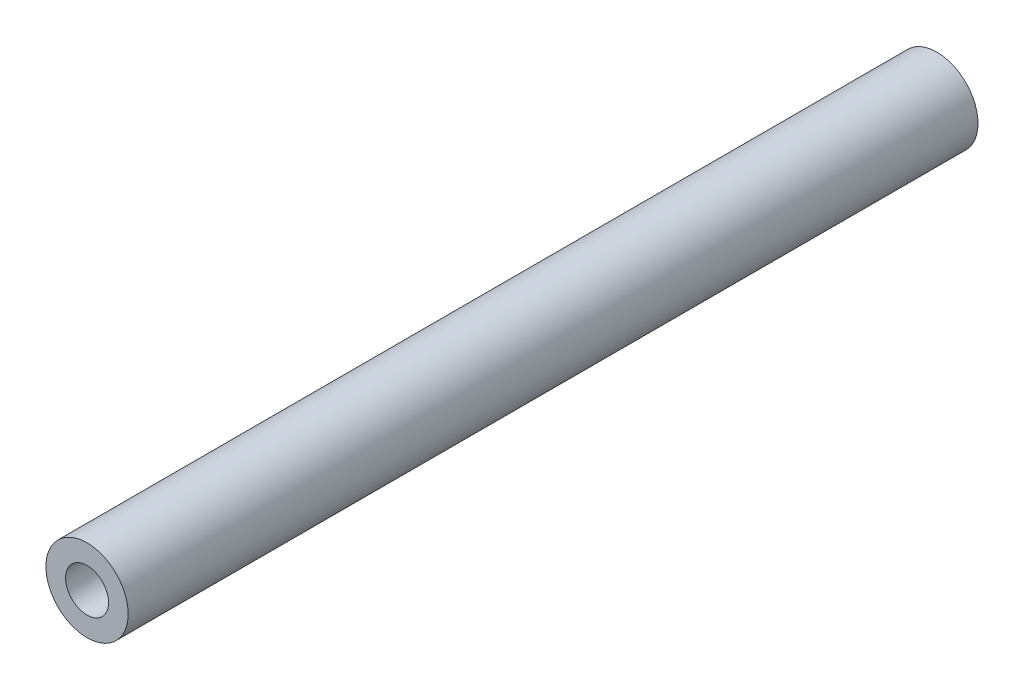
from build123d import *

# Parameters (mm, degrees)
SKETCH1_R           = 4.7625
SKETCH1_R_2         = 2.4892
BOSS_EXTRUDE1_DEPTH = 98.425


with BuildPart() as part:
    # Sketch1 → Boss-Extrude1 (new body)
    with BuildSketch(Plane.XY):
        Circle(SKETCH1_R)
        Circle(SKETCH1_R_2, mode=Mode.SUBTRACT)
    extrude(amount=BOSS_EXTRUDE1_DEPTH)


solid = part.part
